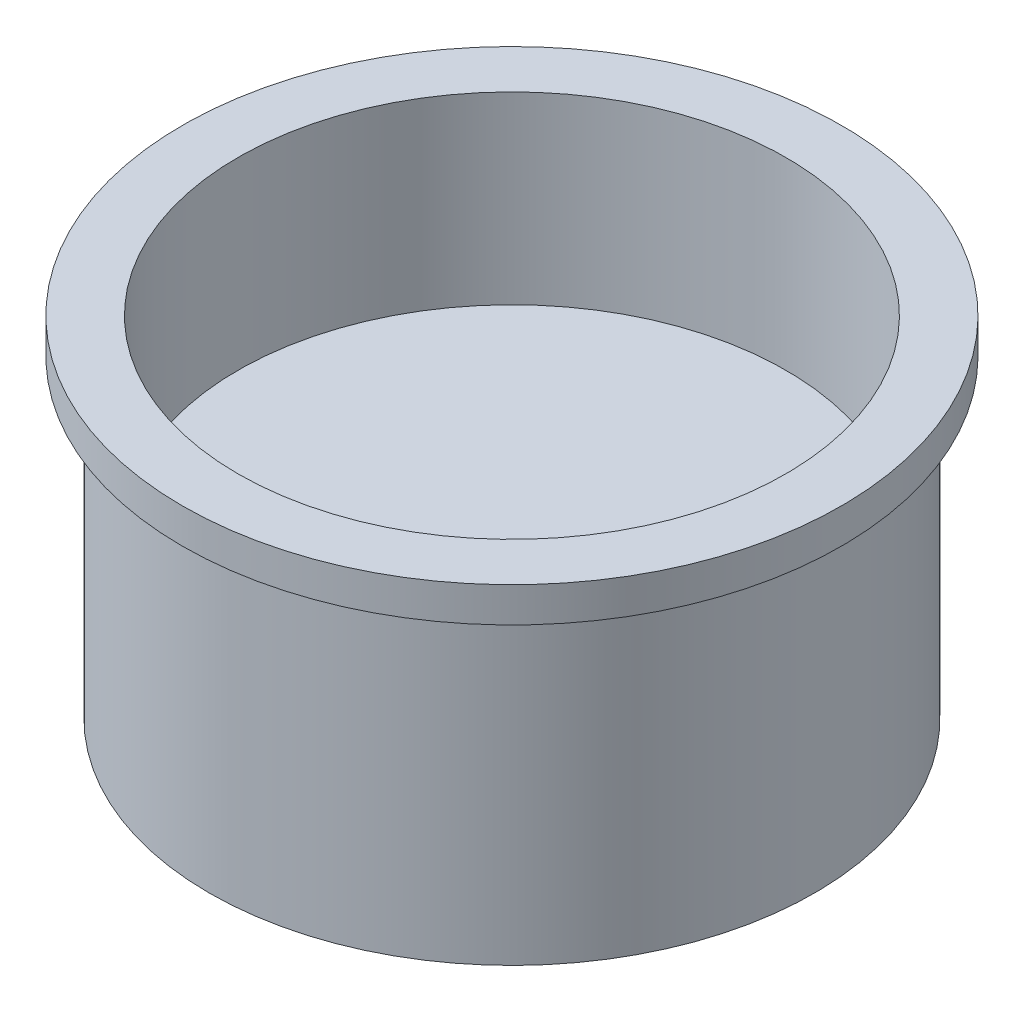
from build123d import *

# Parameters (mm, degrees)
SKETCH1_R           = 12.15
BOSS_EXTRUDE1_DEPTH = 14
SKETCH2_R           = 11
CUT_EXTRUDE1_DEPTH  = 7.4
BOSS_EXTRUDE2_START = -1.4
SKETCH3_R           = 13.23
SKETCH3_R_2         = 12.15
BOSS_EXTRUDE2_DEPTH = 1.4


with BuildPart() as part:
    # Sketch1 → Boss-Extrude1 (new body)
    with BuildSketch(Plane(origin=(0, 0, 0), x_dir=(1, 0, 0), z_dir=(0, 1, 0))):
        Circle(SKETCH1_R)
    extrude(amount=BOSS_EXTRUDE1_DEPTH)

    # Sketch2 → Cut-Extrude1 (cut)
    with BuildSketch(Plane(origin=(0, 14, 0), x_dir=(1, 0, 0), z_dir=(0, 1, 0))):
        Circle(SKETCH2_R)
    extrude(amount=-CUT_EXTRUDE1_DEPTH, mode=Mode.SUBTRACT)

    # Sketch3 → Boss-Extrude2 (add)
    with BuildSketch(Plane(origin=(0, 14, 0), x_dir=(1, 0, 0), z_dir=(0, 1, 0)).offset(BOSS_EXTRUDE2_START)):
        Circle(SKETCH3_R)
        Circle(SKETCH3_R_2, mode=Mode.SUBTRACT)
    extrude(amount=BOSS_EXTRUDE2_DEPTH)


solid = part.part
